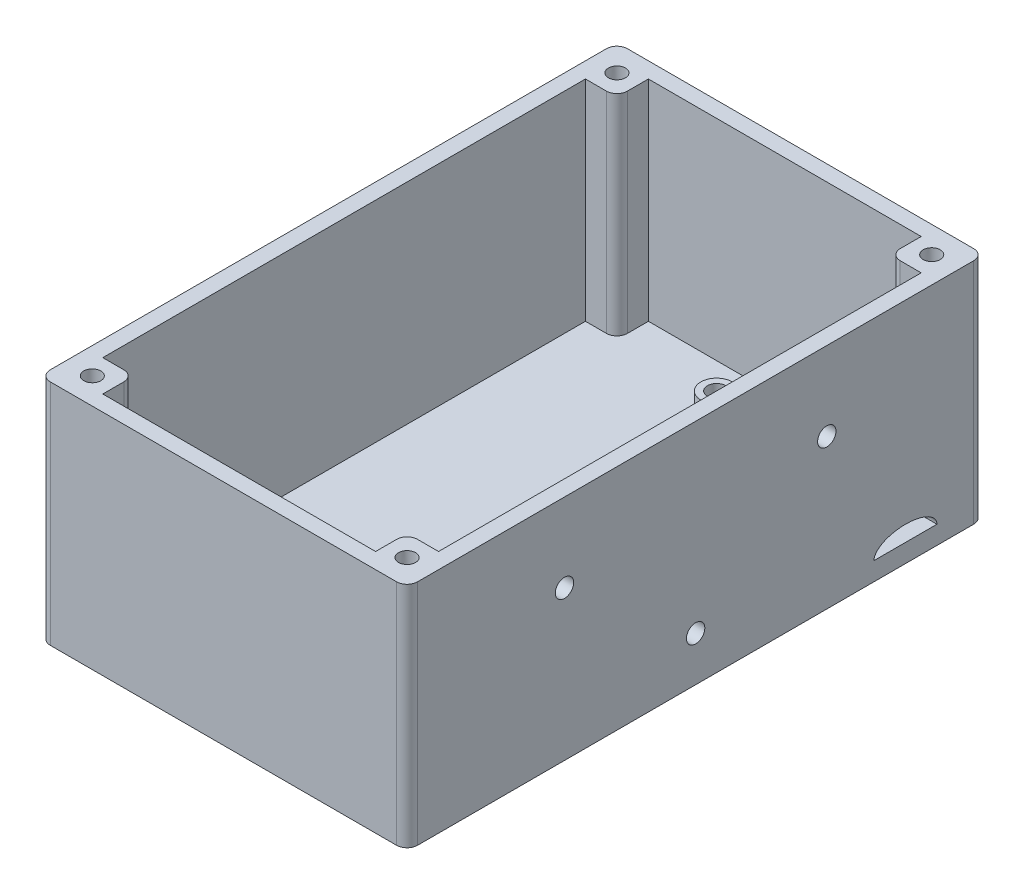
from build123d import *

# Parameters (mm, degrees)
SKETCH1_W                             = 70
SKETCH1_H                             = 110
BOTTOM_DEPTH                          = 3.5
SKETCH3_W                             = 70
SKETCH3_H                             = 110
WALL_DEPTH                            = 40
SKETCH4_R                             = 1.625
TOP_PLATE_SCREW_HOLES_DEPTH           = 30
TOP_PLATE_SCREW_HOLES_DRAFT           = -1
TOP_PLATE_SCREW_HOLES_PROFILE_2_DEPTH = 30
TOP_PLATE_SCREW_HOLES_PROFILE_2_DRAFT = -1
TOP_PLATE_SCREW_HOLES_PROFILE_3_DEPTH = 30
TOP_PLATE_SCREW_HOLES_PROFILE_3_DRAFT = -1
TOP_PLATE_SCREW_HOLES_PROFILE_4_DEPTH = 30
TOP_PLATE_SCREW_HOLES_PROFILE_4_DRAFT = -1
FILLET1_R                             = 2
FILLET2_R                             = 2
FILLET3_R                             = 2
FILLET4_R                             = 2
FILLET5_R                             = 2
FILLET6_R                             = 2
FILLET7_R                             = 2
FILLET8_R                             = 2
M4_MOUNT_R                            = 2.1
M4_MOUNT_CUT_DEPTH                    = 77.485292704
CABLE_PASS_CUT_DEPTH                  = 10
SKETCH6_R                             = 1.75
M3_CONNECTION_CUT_DEPTH               = 10
SKETCH7_R                             = 3
M3_BOARD_MOUNT_EXT_DEPTH              = 5
SKETCH8_R                             = 1.75
M3_BOARD_SCREW_CUT_DEPTH              = 74.993243029
M3_NUT_CIRCUIT_BOARD_CUT_DEPTH        = 3.5


with BuildPart() as part:
    # Sketch1 → Bottom (new body)
    with BuildSketch(Plane(origin=(0, 0, 0), x_dir=(1, 0, 0), z_dir=(0, 1, 0))):
        Rectangle(SKETCH1_W, SKETCH1_H)
    extrude(amount=BOTTOM_DEPTH)

    # Sketch3 → Wall (add)
    with BuildSketch(Plane(origin=(0, 3.5, 0), x_dir=(1, 0, 0), z_dir=(0, 1, 0))):
        Rectangle(SKETCH3_W, SKETCH3_H)
        Polygon((-26, 52), (-4, 52), (26, 52), (26, 46), (32, 46), (32, -46), (26, -46), (26, -52), (4, -52), (-26, -52), (-26, -46), (-32, -46), (-32, 46), (-26, 46), align=None, mode=Mode.SUBTRACT)
    extrude(amount=WALL_DEPTH)


with BuildPart() as top_plate_screw_holes_tool:
    # Sketch4 → Top Plate Screw Holes (with draft: the straight prism first)
    with BuildSketch(Plane(origin=(0, 43.5, 0), x_dir=(1, 0, 0), z_dir=(0, 1, 0))):
        with Locations((-30, 50)):
            Circle(SKETCH4_R)
    extrude(amount=-TOP_PLATE_SCREW_HOLES_DEPTH)
    # Top Plate Screw Holes: the draft: its side faces are tilted about the plane it starts from
    top_plate_screw_holes_sides = [top_plate_screw_holes_tool.faces().sort_by_distance(p)[0] for p in [
        (-31.625, 28.5, -50),
    ]]
    draft(top_plate_screw_holes_sides, Plane(origin=(0, 43.5, 0), x_dir=(1, 0, 0), z_dir=(0, 1, 0)), TOP_PLATE_SCREW_HOLES_DRAFT)


with BuildPart() as part_1:
    add(part.part)

    # Top Plate Screw Holes: cut by top_plate_screw_holes_tool
    add(top_plate_screw_holes_tool.part, mode=Mode.SUBTRACT)


with BuildPart() as top_plate_screw_holes_profile_2_tool:
    # Sketch4 → Top Plate Screw Holes profile 2 (with draft: the straight prism first)
    with BuildSketch(Plane(origin=(0, 43.5, 0), x_dir=(1, 0, 0), z_dir=(0, 1, 0))):
        with Locations((30, 50)):
            Circle(SKETCH4_R)
    extrude(amount=-TOP_PLATE_SCREW_HOLES_PROFILE_2_DEPTH)
    # Top Plate Screw Holes profile 2: the draft: its side faces are tilted about the plane it starts from
    top_plate_screw_holes_profile_2_sides = [top_plate_screw_holes_profile_2_tool.faces().sort_by_distance(p)[0] for p in [
        (28.375, 28.5, -50),
    ]]
    draft(top_plate_screw_holes_profile_2_sides, Plane(origin=(0, 43.5, 0), x_dir=(1, 0, 0), z_dir=(0, 1, 0)), TOP_PLATE_SCREW_HOLES_PROFILE_2_DRAFT)


with BuildPart() as part_2:
    add(part_1.part)

    # Top Plate Screw Holes profile 2: cut by top_plate_screw_holes_profile_2_tool
    add(top_plate_screw_holes_profile_2_tool.part, mode=Mode.SUBTRACT)


with BuildPart() as top_plate_screw_holes_profile_3_tool:
    # Sketch4 → Top Plate Screw Holes profile 3 (with draft: the straight prism first)
    with BuildSketch(Plane(origin=(0, 43.5, 0), x_dir=(1, 0, 0), z_dir=(0, 1, 0))):
        with Locations((30, -50)):
            Circle(SKETCH4_R)
    extrude(amount=-TOP_PLATE_SCREW_HOLES_PROFILE_3_DEPTH)
    # Top Plate Screw Holes profile 3: the draft: its side faces are tilted about the plane it starts from
    top_plate_screw_holes_profile_3_sides = [top_plate_screw_holes_profile_3_tool.faces().sort_by_distance(p)[0] for p in [
        (28.375, 28.5, 50),
    ]]
    draft(top_plate_screw_holes_profile_3_sides, Plane(origin=(0, 43.5, 0), x_dir=(1, 0, 0), z_dir=(0, 1, 0)), TOP_PLATE_SCREW_HOLES_PROFILE_3_DRAFT)


with BuildPart() as part_3:
    add(part_2.part)

    # Top Plate Screw Holes profile 3: cut by top_plate_screw_holes_profile_3_tool
    add(top_plate_screw_holes_profile_3_tool.part, mode=Mode.SUBTRACT)


with BuildPart() as top_plate_screw_holes_profile_4_tool:
    # Sketch4 → Top Plate Screw Holes profile 4 (with draft: the straight prism first)
    with BuildSketch(Plane(origin=(0, 43.5, 0), x_dir=(1, 0, 0), z_dir=(0, 1, 0))):
        with Locations((-30, -50)):
            Circle(SKETCH4_R)
    extrude(amount=-TOP_PLATE_SCREW_HOLES_PROFILE_4_DEPTH)
    # Top Plate Screw Holes profile 4: the draft: its side faces are tilted about the plane it starts from
    top_plate_screw_holes_profile_4_sides = [top_plate_screw_holes_profile_4_tool.faces().sort_by_distance(p)[0] for p in [
        (-31.625, 28.5, 50),
    ]]
    draft(top_plate_screw_holes_profile_4_sides, Plane(origin=(0, 43.5, 0), x_dir=(1, 0, 0), z_dir=(0, 1, 0)), TOP_PLATE_SCREW_HOLES_PROFILE_4_DRAFT)


with BuildPart() as part_4:
    add(part_3.part)

    # Top Plate Screw Holes profile 4: cut by top_plate_screw_holes_profile_4_tool
    add(top_plate_screw_holes_profile_4_tool.part, mode=Mode.SUBTRACT)

    # Fillet1
    fillet1_edges = [part_4.edges().sort_by_distance(p)[0] for p in [
        (-26, 23.5, 46),
    ]]
    fillet(fillet1_edges, radius=FILLET1_R)

    # Fillet2
    fillet2_edges = [part_4.edges().sort_by_distance(p)[0] for p in [
        (26, 23.5, 46),
    ]]
    fillet(fillet2_edges, radius=FILLET2_R)

    # Fillet3
    fillet3_edges = [part_4.edges().sort_by_distance(p)[0] for p in [
        (26, 23.5, -46),
    ]]
    fillet(fillet3_edges, radius=FILLET3_R)

    # Fillet4
    fillet4_edges = [part_4.edges().sort_by_distance(p)[0] for p in [
        (-26, 23.5, -46),
    ]]
    fillet(fillet4_edges, radius=FILLET4_R)

    # Fillet5
    fillet5_edges = [part_4.edges().sort_by_distance(p)[0] for p in [
        (-35, 21.75, -55),
    ]]
    fillet(fillet5_edges, radius=FILLET5_R)

    # Fillet6
    fillet6_edges = [part_4.edges().sort_by_distance(p)[0] for p in [
        (35, 21.75, -55),
    ]]
    fillet(fillet6_edges, radius=FILLET6_R)

    # Fillet7
    fillet7_edges = [part_4.edges().sort_by_distance(p)[0] for p in [
        (35, 21.75, 55),
    ]]
    fillet(fillet7_edges, radius=FILLET7_R)

    # Fillet8
    fillet8_edges = [part_4.edges().sort_by_distance(p)[0] for p in [
        (-35, 21.75, 55),
    ]]
    fillet(fillet8_edges, radius=FILLET8_R)

    # M4 Mount → M4 Mount Cut (cut, through all)
    with BuildSketch(Plane.XZ.offset(-3.5)):
        with Locations((0, -20)):
            Circle(M4_MOUNT_R)
        with Locations((0, 20)):
            Circle(M4_MOUNT_R)
    extrude(amount=M4_MOUNT_CUT_DEPTH, mode=Mode.SUBTRACT)

    # M4 Screw CUT cone 1 section (through the dimple's axis) → M4 Screw CUT (revolve, cut)
    with BuildSketch(Plane(origin=(0, 3.5, 20), x_dir=(0, 0, 1), z_dir=(1, 0, 0))):
        Polygon((0, 0), (3.75, 0), (0, 3.75), align=None)
    revolve(axis=Axis((0, 3.5, 20), (0, -1, 0)), mode=Mode.SUBTRACT)

    # M4 Screw CUT cone 2 section (through the dimple's axis) → M4 Screw CUT cone 2 (revolve, cut)
    with BuildSketch(Plane(origin=(0, 3.5, -20), x_dir=(0, 0, 1), z_dir=(1, 0, 0))):
        Polygon((0, 0), (3.75, 0), (0, 3.75), align=None)
    revolve(axis=Axis((0, 3.5, -20), (0, -1, 0)), mode=Mode.SUBTRACT)

    # Sketch5 → Cable Pass CUT (cut)
    with BuildSketch(Plane.ZY.offset(-32)):
        with BuildLine():
            Line((-46, 3.5), (-34, 3.5))
            add(Edge.make_bspline(
                [(-34, 3.5), (-34, 6.5), (-40, 6.5), (-46, 6.5), (-46, 3.5)],
                knots=[0, 0, 0, 1.570796327, 1.570796327, 3.141592654, 3.141592654, 3.141592654], degree=2, weights=[1, 0.707106781, 1, 0.707106781, 1]))
        make_face()
    extrude(amount=-CABLE_PASS_CUT_DEPTH, mode=Mode.SUBTRACT)

    # Sketch6 → M3 Connection CUT (cut)
    with BuildSketch(Plane.ZY.offset(-32)):
        with Locations((-25, 28.5)):
            Circle(SKETCH6_R)
        with Locations((25, 28.5)):
            Circle(SKETCH6_R)
        with Locations((0, 8.5)):
            Circle(SKETCH6_R)
    extrude(amount=-M3_CONNECTION_CUT_DEPTH, mode=Mode.SUBTRACT)

    # Sketch7 → M3 Board Mount EXT (add)
    with BuildSketch(Plane(origin=(0, 3.5, 0), x_dir=(1, 0, 0), z_dir=(0, 1, 0))):
        with Locations((12, 42)):
            Circle(SKETCH7_R)
        with Locations((12, 27)):
            Circle(SKETCH7_R)
        with Locations((-3, 42)):
            Circle(SKETCH7_R)
    extrude(amount=M3_BOARD_MOUNT_EXT_DEPTH)

    # Sketch8 → M3 Board Screw CUT (cut, through all)
    with BuildSketch(Plane(origin=(0, 8.5, 0), x_dir=(1, 0, 0), z_dir=(0, 1, 0))):
        with Locations((12, 42)):
            Circle(SKETCH8_R)
        with Locations((-3, 42)):
            Circle(SKETCH8_R)
        with Locations((12, 27)):
            Circle(SKETCH8_R)
    extrude(amount=-M3_BOARD_SCREW_CUT_DEPTH, mode=Mode.SUBTRACT)

    # Sketch9 → M3 Nut Circuit Board CUT (cut)
    with BuildSketch(Plane.XZ):
        Polygon((-3, -38.824573519), (-5.75, -40.41228676), (-5.75, -43.58771324), (-3, -45.175426481), (-0.25, -43.58771324), (-0.25, -40.41228676), align=None)
        Polygon((12, -38.824573519), (9.25, -40.41228676), (9.25, -43.58771324), (12, -45.175426481), (14.75, -43.58771324), (14.75, -40.41228676), align=None)
        Polygon((12, -23.824573519), (9.25, -25.41228676), (9.25, -28.58771324), (12, -30.175426481), (14.75, -28.58771324), (14.75, -25.41228676), align=None)
    extrude(amount=-M3_NUT_CIRCUIT_BOARD_CUT_DEPTH, mode=Mode.SUBTRACT)


solid = part_4.part
